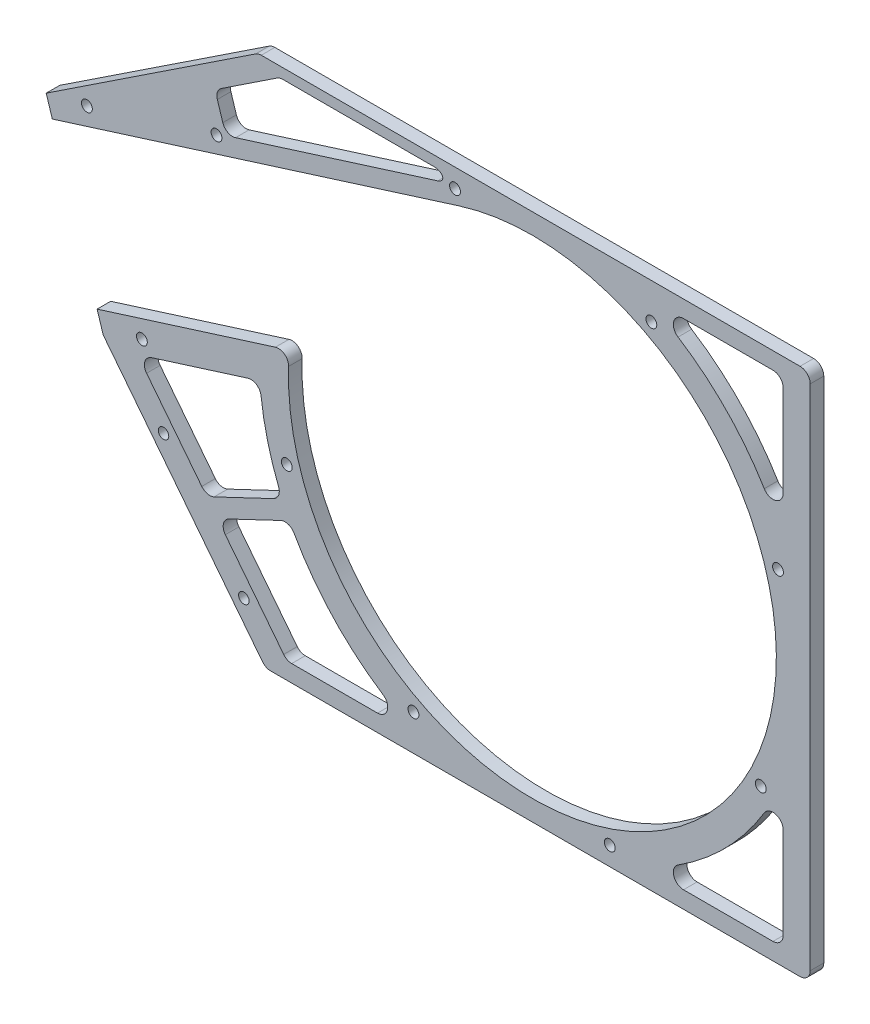
from build123d import *

# Parameters (mm, degrees)
SKETCH_1_W           = 232.8
SKETCH_1_H           = 162
SKETCH_1_R           = 72
EXTRUDE_1_DEPTH      = 4
CUT_EXTRUDE_START    = -10
CUT_EXTRUDE_2_DEPTH  = 10
EXTRUDE_2_DEPTH      = 4
CUT_EXTRUDE_3_DEPTH  = 10
SKETCH_5_R           = 1.6
CUT_EXTRUDE_4_DEPTH  = 10
SKETCH_9_R           = 1.6
CUT_EXTRUDE_5_DEPTH  = 10
SKETCH_10_R          = 1.6
CUT_EXTRUDE_6_DEPTH  = 10
SKETCH_11_R          = 1.6
CUT_EXTRUDE_7_DEPTH  = 10
CUT_EXTRUDE_8_DEPTH  = 10
FILLET_1_R           = 3
FILLET_2_R           = 1.1
FILLET_3_R           = 3
CUT_EXTRUDE_9_DEPTH  = 10
FILLET_4_R           = 3
SKETCH_14_W          = 34.4
SKETCH_14_H          = 162
CUT_EXTRUDE_10_DEPTH = 10
CUT_EXTRUDE_11_DEPTH = 10
FILLET_5_R           = 3
SKETCH_16_R          = 1.55
CUT_EXTRUDE_12_DEPTH = 10
SKETCH_17_W          = 200
SKETCH_17_H          = 10
CUT_EXTRUDE_13_DEPTH = 5
FILLET_6_R           = 3


with BuildPart() as part:
    # 草图1 → 凸台-拉伸1 (new body)
    with BuildSketch(Plane.XY):
        Rectangle(SKETCH_1_W, SKETCH_1_H)
        Circle(SKETCH_1_R, mode=Mode.SUBTRACT)
    extrude(amount=EXTRUDE_1_DEPTH)

    # 草图3 → 切除-拉伸2 (cut)
    with BuildSketch(Plane.XY.offset(4).offset(CUT_EXTRUDE_START)):
        with BuildLine():
            Line((-21.634615385, 68.67272688), (-116.4, 38.817895988))
            Line((-116.4, 38.817895988), (-116.4, -7.313954951))
            Line((-116.4, -7.313954951), (-71.680591647, 6.774421088))
            ThreePointArc((-71.680591647, 6.774421088), (-55.989124219, 45.268288781), (-21.634615385, 68.67272688))
        make_face()
    extrude(amount=CUT_EXTRUDE_2_DEPTH, mode=Mode.SUBTRACT)

    # 草图6 → 凸台-拉伸2 (add)
    with BuildSketch(Plane.XY.offset(4)):
        Polygon((-126.671662246, -16.840640315), (-116.4, -29.949880057), (-116.4, -7.313954951), (-128.474546862, -11.117913075), align=None)
        Polygon((-116.4, 38.817895988), (-116.4, 54.514482194), (-143.498585323, 36.571480592), (-141.695700708, 30.848753352), align=None)
    extrude(amount=-EXTRUDE_2_DEPTH)

    # 草图7 → 切除-拉伸3 (cut)
    with BuildSketch(Plane.XY.offset(4)):
        Polygon((-116.4, -29.949880057), (-76.4, -81), (-116.4, -81), align=None)
        Polygon((-116.4, 54.514482194), (-76.4, 81), (-116.4, 81), align=None)
    extrude(amount=-CUT_EXTRUDE_3_DEPTH, mode=Mode.SUBTRACT)

    # 草图5 → 切除-拉伸4 (cut)
    with BuildSketch(Plane.XY.offset(4)):
        with Locations((-115.25907459, -12.196774271)):
            Circle(SKETCH_5_R)
        with Locations((-131.485036128, 39.307770889)):
            Circle(SKETCH_5_R)
    extrude(amount=-CUT_EXTRUDE_4_DEPTH, mode=Mode.SUBTRACT)

    # 草图9 → 切除-拉伸5 (cut)
    with BuildSketch(Plane.XY.offset(4)):
        with Locations((-22.836538462, 72.487878374)):
            Circle(SKETCH_9_R)
        with Locations((72.487878374, 22.836538462)):
            Circle(SKETCH_9_R)
        with Locations((22.836538462, -72.487878374)):
            Circle(SKETCH_9_R)
        with Locations((-72.487878374, -22.836538462)):
            Circle(SKETCH_9_R)
    extrude(amount=-CUT_EXTRUDE_5_DEPTH, mode=Mode.SUBTRACT)

    # 草图10 → 切除-拉伸6 (cut)
    with BuildSketch(Plane.XY.offset(4)):
        with Locations((-93.229198124, 50.99070111)):
            Circle(SKETCH_10_R)
    extrude(amount=-CUT_EXTRUDE_6_DEPTH, mode=Mode.SUBTRACT)

    # 草图11 → 切除-拉伸7 (cut)
    with BuildSketch(Plane(origin=(0, 0, 0), x_dir=(-1, 0, 0), z_dir=(0, 0, -1))):
        with Locations((-35.108799147, 67.404541557)):
            Circle(SKETCH_11_R)
        with Locations((-67.404541557, -35.108799147)):
            Circle(SKETCH_11_R)
        with Locations((35.108799147, -67.404541557)):
            Circle(SKETCH_11_R)
    extrude(amount=-CUT_EXTRUDE_7_DEPTH, mode=Mode.SUBTRACT)

    # 草图12 → 切除-拉伸8 (cut)
    with BuildSketch(Plane.XY.offset(4)):
        Polygon((-93.668674526, 62.369689763), (-74.593630829, 75), (-25.836538462, 75), (-25.836538462, 72.5912113), (-90.473635724, 52.227978291), align=None)
    extrude(amount=-CUT_EXTRUDE_8_DEPTH, mode=Mode.SUBTRACT)

    # 圆角1
    # the kernel refuses this fillet: 3 mm, written as the material it adds along each edge
    with BuildSketch(Plane(origin=(-25.836538462, 75, 4), x_dir=(0, -1, 0), z_dir=(0, 0, -1)), Plane(origin=(-90.473635724, 52.227978291, 4), x_dir=(-0.3004807692307691, 0.95378787333583, 0), z_dir=(0, 0, -1))) as fillet_1_piece_1:
        with BuildLine():
            CenterArc((FILLET_1_R, FILLET_1_R), FILLET_1_R, 180, 90)
            Line((0, FILLET_1_R), (0, 0))
            Line((0, 0), (FILLET_1_R, 0))
        make_face()
    extrude(amount=4)
    with BuildSketch(Plane(origin=(-25.836538462, 72.5912113, 4), x_dir=(-0.9537878733358296, -0.30048076923076983, 0), z_dir=(0, 0, -1))) as fillet_1_piece_2:
        with BuildLine():
            CenterArc((FILLET_1_R * 0.733411747334, FILLET_1_R), FILLET_1_R, 197.486481518, 72.513518482)
            Line((-FILLET_1_R * 0.220376126002, FILLET_1_R * 0.699519230769), (0, 0))
            Line((0, 0), (FILLET_1_R * 0.733411747334, 0))
        make_face()
    extrude(amount=4)
    with BuildSketch(Plane(origin=(-93.668674526, 62.369689763, 4), x_dir=(0.3004807692307694, -0.95378787333583, 0), z_dir=(0, 0, -1))) as fillet_1_piece_3:
        with BuildLine():
            CenterArc((FILLET_1_R * 0.753231578374, -FILLET_1_R), FILLET_1_R, 90, 73.976427328)
            Line((-FILLET_1_R * 0.207916633287, -FILLET_1_R * 0.72396718452), (0, 0))
            Line((0, 0), (FILLET_1_R * 0.753231578374, 0))
        make_face()
    extrude(amount=4)
    with BuildSketch(Plane(origin=(-74.593630829, 75, 4), x_dir=(1, 0, 0), z_dir=(0, 0, -1))) as fillet_1_piece_4:
        with BuildLine():
            CenterArc((FILLET_1_R * 0.30106152849, FILLET_1_R), FILLET_1_R, 236.48994581, 33.51005419)
            Line((-FILLET_1_R * 0.251021777541, FILLET_1_R * 0.166211043968), (0, 0))
            Line((0, 0), (FILLET_1_R * 0.30106152849, 0))
        make_face()
    extrude(amount=4)

    # 圆角2
    fillet_2_edges = [part.edges().sort_by_distance(p)[0] for p in [
        (-26.180986438, 73.395723271, 2),
    ]]
    fillet(fillet_2_edges, radius=FILLET_2_R)

    # 圆角3
    fillet_3_edges = [part.edges().sort_by_distance(p)[0] for p in [
        (-71.680591647, 6.774421088, 2),
        (-76.4, -81, 2),
        (-76.4, 81, 2),
    ]]
    fillet(fillet_3_edges, radius=FILLET_3_R)

    # 草图13 → 切除-拉伸9 (cut)
    with BuildSketch(Plane.XY.offset(4)):
        with BuildLine():
            Line((-71.696957036, -36.822633688), (-92.944059946, -46.914680662))
            Line((-92.944059946, -46.914680662), (-72.505072248, -73))
            Line((-72.505072248, -73), (-34.166650407, -73))
            ThreePointArc((-34.166650407, -73), (-55.937253271, -58.029162466), (-71.696957036, -36.822633688))
        make_face()
        with BuildLine():
            Line((-80.417945117, -5.414250016), (-116.543877682, -16.79534251))
            Line((-116.543877682, -16.79534251), (-96.104889984, -42.880661848))
            Line((-96.104889984, -42.880661848), (-73.842184412, -32.306219235))
            ThreePointArc((-73.842184412, -32.306219235), (-78.293303626, -19.144675692), (-80.417945117, -5.414250016))
        make_face()
    extrude(amount=-CUT_EXTRUDE_9_DEPTH, mode=Mode.SUBTRACT)

    # 圆角4
    fillet_4_edges = [part.edges().sort_by_distance(p)[0] for p in [
        (-80.417945117, -5.414250016, 2),
        (-73.842184412, -32.306219235, 2),
        (-96.104889984, -42.880661848, 2),
        (-116.543877682, -16.79534251, 2),
        (-71.696957036, -36.822633688, 2),
        (-34.166650407, -73, 2),
        (-72.505072248, -73, 2),
        (-92.944059946, -46.914680662, 2),
    ]]
    fillet(fillet_4_edges, radius=FILLET_4_R)

    # 草图14 → 切除-拉伸10 (cut)
    with BuildSketch(Plane.XY.offset(4)):
        with Locations((99.2, 0)):
            Rectangle(SKETCH_14_W, SKETCH_14_H)
    extrude(amount=-CUT_EXTRUDE_10_DEPTH, mode=Mode.SUBTRACT)

    # 草图15 → 切除-拉伸11 (cut)
    with BuildSketch(Plane.XY.offset(4)):
        with BuildLine():
            Line((32.726136344, 73), (74, 73))
            Line((74, 73), (74, 30.397368307))
            ThreePointArc((74, 30.397368307), (57.457489516, 55.665401269), (32.726136344, 73))
        make_face()
        with BuildLine():
            Line((74, -73), (74, -30.397368307))
            ThreePointArc((74, -30.397368307), (57.457489516, -55.665401269), (32.726136344, -73))
            Line((32.726136344, -73), (74, -73))
        make_face()
    extrude(amount=-CUT_EXTRUDE_11_DEPTH, mode=Mode.SUBTRACT)

    # 圆角5
    fillet_5_edges = [part.edges().sort_by_distance(p)[0] for p in [
        (82, 81, 2),
        (82, -81, 2),
        (74, 30.397368307, 2),
        (32.726136344, 73, 2),
        (74, 73, 2),
        (32.726136344, -73, 2),
        (74, -30.397368307, 2),
        (74, -73, 2),
    ]]
    fillet(fillet_5_edges, radius=FILLET_5_R)

    # 草图16 → 切除-拉伸12 (cut)
    with BuildSketch(Plane(origin=(0, 0, 0), x_dir=(-1, 0, 0), z_dir=(0, 0, -1))):
        with Locations((108.877259832, -33.065343142)):
            Circle(SKETCH_16_R)
        with Locations((85.167293187, -63.325259168)):
            Circle(SKETCH_16_R)
    extrude(amount=-CUT_EXTRUDE_12_DEPTH, mode=Mode.SUBTRACT)

    # 草图17 → 切除-拉伸13 (cut, symmetric)
    with BuildSketch(Plane.XY.offset(4)):
        with Locations((0, 83)):
            Rectangle(SKETCH_17_W, SKETCH_17_H)
        with Locations((0, -83)):
            Rectangle(SKETCH_17_W, SKETCH_17_H)
    extrude(amount=CUT_EXTRUDE_13_DEPTH, both=True, mode=Mode.SUBTRACT)

    # 圆角6
    fillet_6_edges = [part.edges().sort_by_distance(p)[0] for p in [
        (82, -78, 2),
        (82, 78, 2),
        (-80.930777947, 78, 2),
        (-78.750631108, -78, 2),
    ]]
    fillet(fillet_6_edges, radius=FILLET_6_R)


solid = part.part
